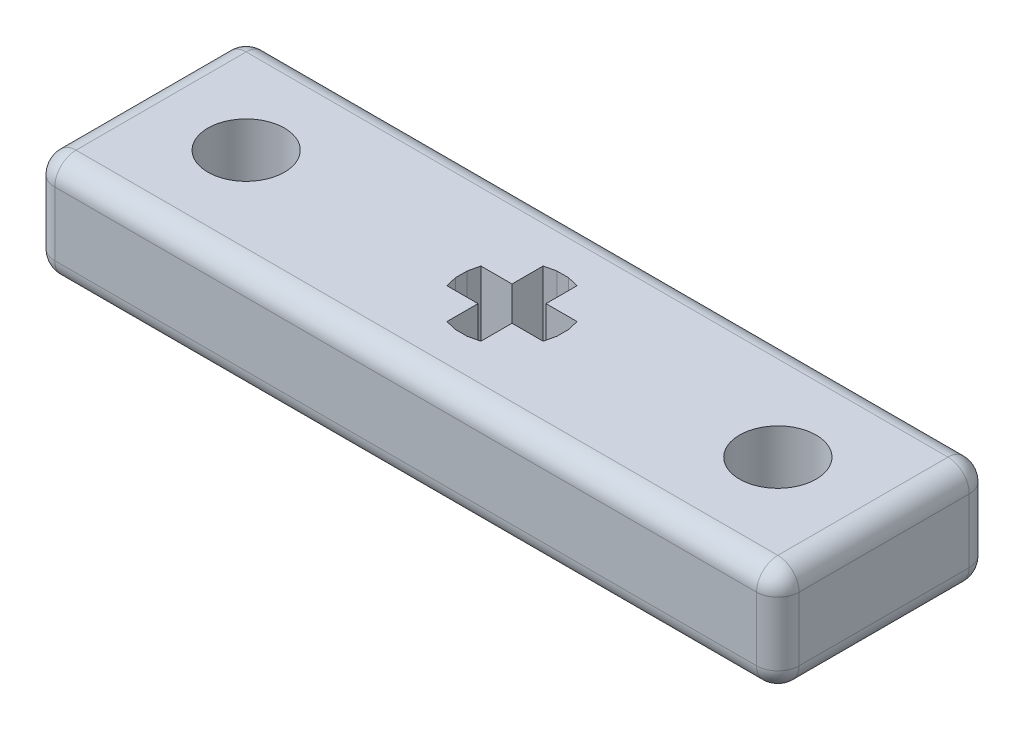
from build123d import *

# Parameters (mm, degrees)
SKETCH1_W            = 35
SKETCH1_H            = 10
BOSS_EXTRUDE1_DEPTH  = 5
FILLET4_R            = 1
M3_CLEARANCE_HOLE1_D = 3.6
FILLET6_R            = 1


with BuildPart() as part:
    # Sketch1 → Boss-Extrude1 (new body)
    with BuildSketch(Plane(origin=(0, 0, 0), x_dir=(1, 0, 0), z_dir=(0, 1, 0))):
        Rectangle(SKETCH1_W, SKETCH1_H)
        Polygon((-0.8, 0.8), (-0.8, 2.2627417), (-0.270125178, 2.384749963), (0.270125178, 2.384749963), (0.8, 2.2627417), (0.8, 0.8), (2.2627417, 0.8), (2.384749963, 0.270125178), (2.384749963, -0.270125178), (2.2627417, -0.8), (0.8, -0.8), (0.8, -2.2627417), (0.270125178, -2.384749963), (-0.270125178, -2.384749963), (-0.8, -2.2627417), (-0.8, -0.8), (-2.2627417, -0.8), (-2.384749963, -0.270125178), (-2.384749963, 0.270125178), (-2.2627417, 0.8), align=None, mode=Mode.SUBTRACT)
    extrude(amount=BOSS_EXTRUDE1_DEPTH)

    # Fillet4
    fillet4_edges = [part.edges().sort_by_distance(p)[0] for p in [
        (17.5, 2.5, -5),
        (17.5, 2.5, 5),
        (-17.5, 2.5, 5),
        (-17.5, 2.5, -5),
    ]]
    fillet(fillet4_edges, radius=FILLET4_R)

    # M3 Clearance Hole1 (through all)
    with Locations(Plane.XZ):
        with Locations((-12.5, 0), (12.5, 0)):
            Hole(M3_CLEARANCE_HOLE1_D / 2)

    # Fillet6
    fillet6_edges = [part.edges().sort_by_distance(p)[0] for p in [
        (-17.207106781, 5, 4.707106781),
        (0, 5, 5),
        (17.207106781, 5, 4.707106781),
        (17.207106781, 5, -4.707106781),
        (0, 5, -5),
        (-17.207106781, 5, -4.707106781),
        (-17.207106781, 0, 4.707106781),
        (0, 0, 5),
        (17.207106781, 0, 4.707106781),
        (17.207106781, 0, -4.707106781),
        (0, 0, -5),
        (-17.207106781, 0, -4.707106781),
        (17.5, 5, 0),
        (17.5, 0, 0),
        (-17.5, 5, 0),
        (-17.5, 0, 0),
    ]]
    fillet(fillet6_edges, radius=FILLET6_R)


solid = part.part
